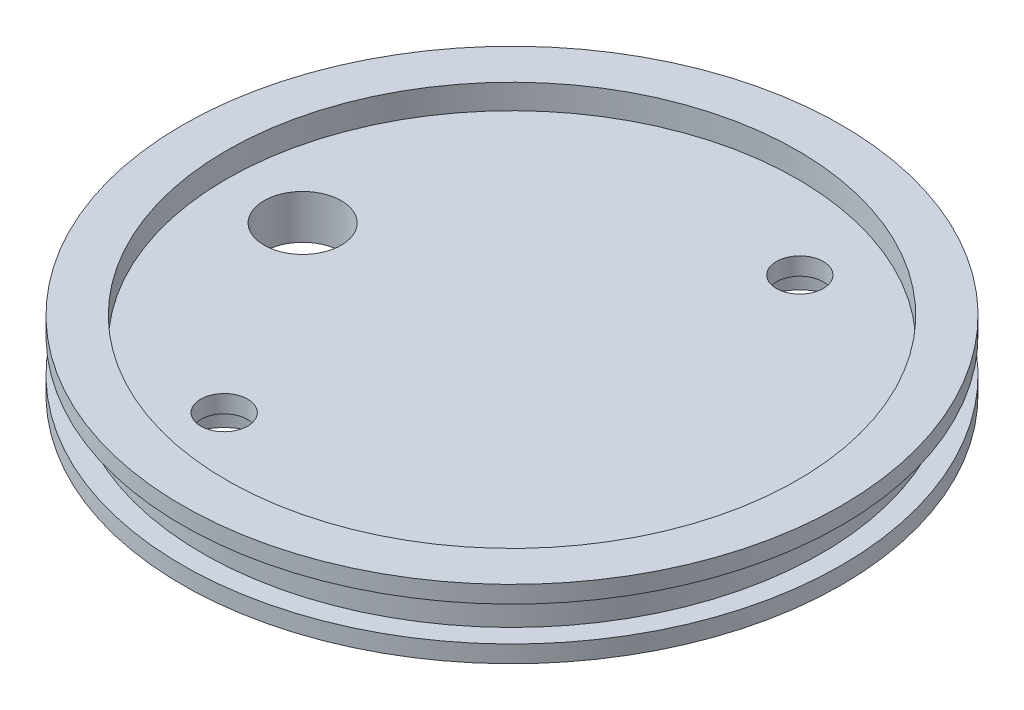
from build123d import *

# Parameters (mm, degrees)
TAP_DRILL_FOR_1_4_TAP_1_4_18_NPT_D                   = 11.1252
CBORE_FOR_1_4_BINDING_HEAD_MACHINE_SCREW_D           = 6.7564
CBORE_FOR_1_4_BINDING_HEAD_MACHINE_SCREW_CBORE_D     = 12.7
CBORE_FOR_1_4_BINDING_HEAD_MACHINE_SCREW_CBORE_DEPTH = 3.81
SKETCH7_R                                            = 11.1125
BOSS_EXTRUDE1_DEPTH                                  = 6.35


with BuildPart() as part:
    # Sketch1 → Revolve1 (revolve)
    with BuildSketch(Plane.XY):
        Polygon((0, 0), (47.498, 0), (47.498, 2.4638), (44.577, 2.4638), (44.577, 7.4422), (47.498, 7.4422), (47.498, 9.906), (41.148, 9.906), (41.148, 6.35), (0, 6.35), align=None)
    revolve(axis=Axis((0, 48.192213231, 0), (0, -1, 0)))

    # Tap Drill for 1/4 Tap - 1/4-18 NPT (through all)
    with Locations(Plane(origin=(0, 6.35, 0), x_dir=(1, 0, 0), z_dir=(0, 1, 0))):
        with Locations((0, 0), (-30.1752, 0)):
            Hole(TAP_DRILL_FOR_1_4_TAP_1_4_18_NPT_D / 2)

    # CBORE for 1/4 Binding Head Machine Screw1 (through all)
    with Locations(Plane.XZ):
        with Locations((12.150198978, -29.333175157), (-12.150198978, 29.333175157)):
            CounterBoreHole(CBORE_FOR_1_4_BINDING_HEAD_MACHINE_SCREW_D / 2, CBORE_FOR_1_4_BINDING_HEAD_MACHINE_SCREW_CBORE_D / 2, CBORE_FOR_1_4_BINDING_HEAD_MACHINE_SCREW_CBORE_DEPTH)

    # Sketch7 → Boss-Extrude1 (add)
    with BuildSketch(Plane(origin=(0, 6.35, 0), x_dir=(1, 0, 0), z_dir=(0, 1, 0))):
        Circle(SKETCH7_R)
    extrude(amount=-BOSS_EXTRUDE1_DEPTH)


solid = part.part
